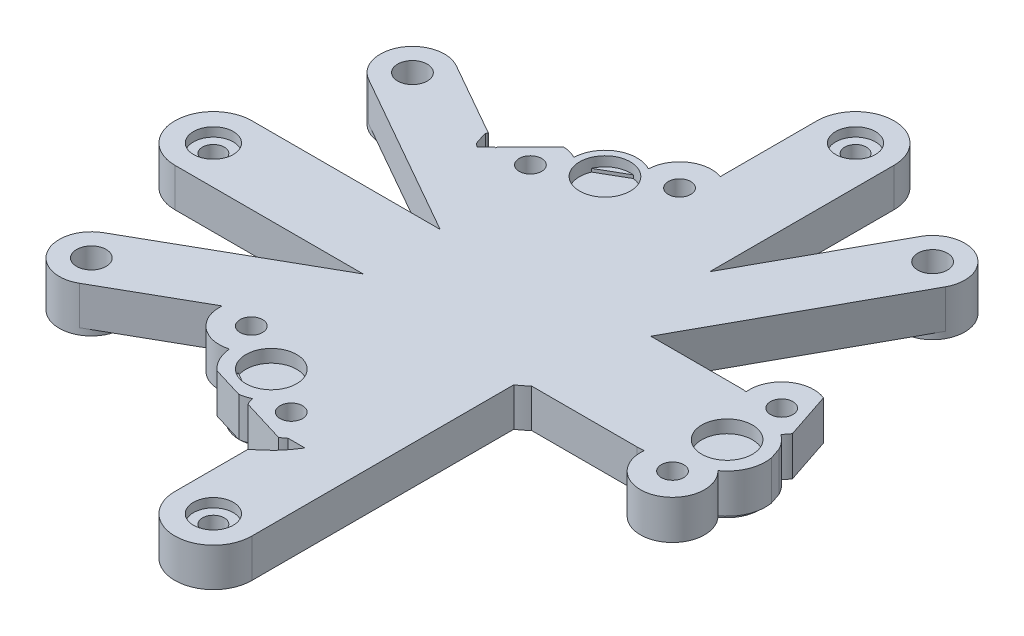
from build123d import *
from build123d.topology import SkipClean

# Parameters (mm, degrees)
BASE_OUTLINE_SKETCH_R          = 3.95
BASE_OUTLINE_SKETCH_R_2        = 1.75
BASE_OUTLINE_SKETCH_R_3        = 3.1
BASE_OUTLINE_SKETCH_R_4        = 2.3
BASE_OUTLINE_DEPTH             = 1.4
INTERFACE_PROFILE_2_SKETCH_R   = 3.95
INTERFACE_PROFILE_2_SKETCH_R_2 = 1.75
INTERFACE_PROFILE_2_SKETCH_R_3 = 1.7
INTERFACE_PROFILE_2_SKETCH_R_4 = 2.3
INTERFACE_PROFILE_2_DEPTH      = 0.1
INTERFACE_PROFILE_3_SKETCH_R   = 1.75
INTERFACE_PROFILE_3_SKETCH_R_2 = 1.7
INTERFACE_PROFILE_3_SKETCH_R_3 = 2.3
INTERFACE_PROFILE_3_DEPTH      = 0.5
INTERFACE_PROFILE_4_SKETCH_R   = 1.75
INTERFACE_PROFILE_4_SKETCH_R_2 = 1.7
INTERFACE_PROFILE_4_SKETCH_R_3 = 2.3
INTERFACE_PROFILE_4_DEPTH      = 1.5
INTERFACE_PROFILE_5_SKETCH_R   = 1.75
INTERFACE_PROFILE_5_SKETCH_R_2 = 2.3
INTERFACE_PROFILE_5_DEPTH      = 0.5
INTERFACE_PROFILE_6_SKETCH_R   = 1.1
INTERFACE_PROFILE_6_SKETCH_R_2 = 2.3
INTERFACE_PROFILE_6_DEPTH      = 1.3
INTERFACE_PROFILE_7_SKETCH_R   = 2.3
INTERFACE_PROFILE_7_DEPTH      = 0.7
INTERFACE_PROFILE_8_SKETCH_R   = 5
INTERFACE_PROFILE_8_SKETCH_R_2 = 2.3
INTERFACE_PROFILE_8_DEPTH      = 0.1
INTERFACE_PROFILE_9_SKETCH_R   = 5
INTERFACE_PROFILE_9_SKETCH_R_2 = 2.3
INTERFACE_PROFILE_9_DEPTH      = 0.9


with BuildPart() as part:
    # Base Outline Sketch → Base Outline (new body)
    with BuildSketch(Plane(origin=(0, 71, 0), x_dir=(1, 0, 0), z_dir=(0, 1, 0))):
        with BuildLine():
            Line((-32.291651246, 8), (-46.185295141, 8))
            Line((-46.185295141, 8), (-29.910571703, 37.590406251))
            ThreePointArc((-29.910571703, 37.590406251), (-31.882057497, 44.381079543), (-38.672730789, 42.409593749))
            Line((-38.672730789, 42.409593749), (-50.291651246, 21.284283828))
            Line((-50.291651246, 21.284283828), (-50.291651246, 50))
            ThreePointArc((-50.291651246, 50), (-56.291651246, 56), (-62.291651246, 50))
            Line((-62.291651246, 50), (-62.291651246, 34.954572734))
            ThreePointArc((-62.291651246, 34.954572734), (-66.315093544, 34.625464052), (-68.784082024, 31.431642464))
            ThreePointArc((-68.784082024, 31.431642464), (-68.883668242, 30.913025667), (-68.927999999, 30.386798062))
            ThreePointArc((-68.927999999, 30.386798062), (-73.791651246, 30.310889132), (-76.289215931, 26.136798062))
            ThreePointArc((-76.289215931, 26.136798062), (-77.35512684, 26.559413065), (-78.489286926, 26.728085547))
            Line((-78.489286926, 26.728085547), (-83.649541024, 21.548414964))
            ThreePointArc((-83.649541024, 21.548414964), (-83.643005829, 21.416889138), (-83.633009125, 21.285581035))
            Line((-83.633009125, 21.285581035), (-83.8107686, 21.386580737))
            Line((-83.8107686, 21.386580737), (-85.20343943, 19.988669705))
            Line((-85.20343943, 19.988669705), (-85.757211082, 20.413215201))
            ThreePointArc((-85.757211082, 20.413215201), (-86.105522751, 21.420146909), (-86.383835717, 22.448628496))
            Line((-86.383835717, 22.448628496), (-86.305419253, 22.677221962))
            Line((-86.305419253, 22.677221962), (-86.256166384, 22.776011296))
            Line((-86.256166384, 22.776011296), (-97.821604208, 29.347282787))
            ThreePointArc((-97.821604208, 29.347282787), (-104.638934033, 27.470047038), (-102.761698284, 20.652717213))
            Line((-102.761698284, 20.652717213), (-76.972915989, 6))
            Line((-76.972915989, 6), (-106.291651246, 6))
            ThreePointArc((-106.291651246, 6), (-112.291651246, 0), (-106.291651246, -6))
            Line((-106.291651246, -6), (-76.972915989, -6))
            Line((-76.972915989, -6), (-102.761698284, -20.652717213))
            ThreePointArc((-102.761698284, -20.652717213), (-105.125718578, -26.277416546), (-100.291651246, -30))
            ThreePointArc((-100.291651246, -30), (-99.0142347, -29.834067332), (-97.821604208, -29.347282787))
            Line((-97.821604208, -29.347282787), (-83.633009125, -21.285581035))
            ThreePointArc((-83.633009125, -21.285581035), (-81.833429855, -25.588743588), (-77.266036714, -26.53458364))
            ThreePointArc((-77.266036714, -26.53458364), (-76.660851993, -28.65876199), (-75.328083566, -30.420042925))
            Line((-75.328083566, -30.420042925), (-70.4166073, -31.916610671))
            ThreePointArc((-70.4166073, -31.916610671), (-69.583050502, -31.73234307), (-68.784082024, -31.431642464))
            ThreePointArc((-68.784082024, -31.431642464), (-68.607205612, -31.999326383), (-68.36419026, -32.541999246))
            Line((-68.36419026, -32.541999246), (-61.538896036, -34.621723271))
            ThreePointArc((-61.538896036, -34.621723271), (-61.075070248, -34.33525847), (-60.645188633, -34))
            Line((-60.645188633, -34), (-58.027344867, -34))
            ThreePointArc((-58.027344867, -34), (-59.924361539, -36.5180637), (-62.291651246, -38.600191578))
            Line((-62.291651246, -38.600191578), (-62.291651246, -50))
            ThreePointArc((-62.291651246, -50), (-56.291651246, -56), (-50.291651246, -50))
            Line((-50.291651246, -50), (-50.291651246, -9.219544457))
            ThreePointArc((-50.291651246, -9.219544457), (-49.489348292, -8.644574861), (-48.741816811, -8))
            Line((-48.741816811, -8), (-32.291651246, -8))
            ThreePointArc((-32.291651246, -8), (-31.774449966, -7.983263921), (-31.259412667, -7.933125709))
            ThreePointArc((-31.259412667, -7.933125709), (-24.59824207, -13.204504795), (-22.824835001, -4.897058824))
            ThreePointArc((-22.824835001, -4.897058824), (-20.756368573, -2.315306833), (-20.370627571, 0.970298223))
            Line((-20.370627571, 0.970298223), (-20.9711323, 2.773459598))
            ThreePointArc((-20.9711323, 2.773459598), (-21.771503753, 3.945664284), (-22.824835001, 4.897058823))
            ThreePointArc((-22.824835001, 4.897058823), (-22.387173453, 5.376691952), (-22.015356327, 5.908995993))
            Line((-22.015356327, 5.908995993), (-24.422675355, 13.137556374))
            ThreePointArc((-24.422675355, 13.137556374), (-29.320205782, 12.478423987), (-31.259412667, 7.933125709))
            ThreePointArc((-31.259412667, 7.933125709), (-31.774449966, 7.983263921), (-32.291651246, 8))
        make_face()
        with Locations(Location((-71.291651246, -25.980762114, 0), (0, 0, 270))):
            Circle(BASE_OUTLINE_SKETCH_R, mode=Mode.SUBTRACT)
        with Locations(Location((-63.930435314, -30.230762114, 0), (0, 0, 270))):
            Circle(BASE_OUTLINE_SKETCH_R_2, mode=Mode.SUBTRACT)
        with Locations(Location((-26.291651246, 0, 0), (0, 0, 270))):
            Circle(BASE_OUTLINE_SKETCH_R, mode=Mode.SUBTRACT)
        with Locations(Location((-56.291651246, -50, 0), (0, 0, 270))):
            Circle(BASE_OUTLINE_SKETCH_R_3, mode=Mode.SUBTRACT)
        with Locations(Location((-26.291651246, -8.5, 0), (0, 0, 270))):
            Circle(BASE_OUTLINE_SKETCH_R_2, mode=Mode.SUBTRACT)
        with Locations(Location((-78.652867178, -21.730762114, 0), (0, 0, 270))):
            Circle(BASE_OUTLINE_SKETCH_R_2, mode=Mode.SUBTRACT)
        with Locations(Location((-100.291651246, -25, 0), (0, 0, 270))):
            Circle(BASE_OUTLINE_SKETCH_R_4, mode=Mode.SUBTRACT)
        with Locations(Location((-71.291651246, 25.980762113, 0), (0, 0, 270))):
            Circle(BASE_OUTLINE_SKETCH_R, mode=Mode.SUBTRACT)
        with Locations(Location((-34.291651246, 40, 0), (0, 0, 270))):
            Circle(BASE_OUTLINE_SKETCH_R_4, mode=Mode.SUBTRACT)
        with Locations(Location((-26.291651246, 8.5, 0), (0, 0, 270))):
            Circle(BASE_OUTLINE_SKETCH_R_2, mode=Mode.SUBTRACT)
        with Locations(Location((-63.930435314, 30.230762113, 0), (0, 0, 270))):
            Circle(BASE_OUTLINE_SKETCH_R_2, mode=Mode.SUBTRACT)
        with Locations(Location((-56.291651246, 50, 0), (0, 0, 270))):
            Circle(BASE_OUTLINE_SKETCH_R_3, mode=Mode.SUBTRACT)
        with Locations(Location((-78.652867178, 21.730762114, 0), (0, 0, 270))):
            Circle(BASE_OUTLINE_SKETCH_R_2, mode=Mode.SUBTRACT)
        with Locations(Location((-106.291651246, 0, 0), (0, 0, 270))):
            Circle(BASE_OUTLINE_SKETCH_R_3, mode=Mode.SUBTRACT)
        with Locations(Location((-100.291651246, 25, 0), (0, 0, 270))):
            Circle(BASE_OUTLINE_SKETCH_R_4, mode=Mode.SUBTRACT)
    extrude(amount=-BASE_OUTLINE_DEPTH)

    # Interface Profile 2 Sketch → Interface Profile 2 (add)
    with BuildSketch(Plane(origin=(0, 69.6, 0), x_dir=(1, 0, 0), z_dir=(0, 1, 0))):
        with BuildLine():
            Line((-32.291651246, 8), (-46.185295141, 8))
            Line((-46.185295141, 8), (-29.910571703, 37.590406251))
            ThreePointArc((-29.910571703, 37.590406251), (-31.882057497, 44.381079543), (-38.672730789, 42.409593749))
            Line((-38.672730789, 42.409593749), (-50.291651246, 21.284283828))
            Line((-50.291651246, 21.284283828), (-50.291651246, 50))
            ThreePointArc((-50.291651246, 50), (-56.291651246, 56), (-62.291651246, 50))
            Line((-62.291651246, 50), (-62.291651246, 34.954572734))
            ThreePointArc((-62.291651246, 34.954572734), (-66.315093544, 34.625464052), (-68.784082024, 31.431642464))
            ThreePointArc((-68.784082024, 31.431642464), (-68.883668242, 30.913025667), (-68.927999999, 30.386798062))
            ThreePointArc((-68.927999999, 30.386798062), (-73.791651246, 30.310889132), (-76.289215931, 26.136798062))
            ThreePointArc((-76.289215931, 26.136798062), (-77.35512684, 26.559413065), (-78.489286926, 26.728085547))
            Line((-78.489286926, 26.728085547), (-83.649541024, 21.548414964))
            ThreePointArc((-83.649541024, 21.548414964), (-83.643005829, 21.416889138), (-83.633009125, 21.285581035))
            Line((-83.633009125, 21.285581035), (-83.8107686, 21.386580737))
            Line((-83.8107686, 21.386580737), (-85.20343943, 19.988669705))
            Line((-85.20343943, 19.988669705), (-85.757211082, 20.413215201))
            ThreePointArc((-85.757211082, 20.413215201), (-86.105522751, 21.420146909), (-86.383835717, 22.448628496))
            Line((-86.383835717, 22.448628496), (-86.305419253, 22.677221962))
            Line((-86.305419253, 22.677221962), (-86.256166384, 22.776011296))
            Line((-86.256166384, 22.776011296), (-97.821604208, 29.347282787))
            ThreePointArc((-97.821604208, 29.347282787), (-104.638934033, 27.470047038), (-102.761698284, 20.652717213))
            Line((-102.761698284, 20.652717213), (-76.972915989, 6))
            Line((-76.972915989, 6), (-106.291651246, 6))
            ThreePointArc((-106.291651246, 6), (-112.291651246, 0), (-106.291651246, -6))
            Line((-106.291651246, -6), (-76.972915989, -6))
            Line((-76.972915989, -6), (-102.761698284, -20.652717213))
            ThreePointArc((-102.761698284, -20.652717213), (-105.125718578, -26.277416546), (-100.291651246, -30))
            ThreePointArc((-100.291651246, -30), (-99.0142347, -29.834067332), (-97.821604208, -29.347282787))
            Line((-97.821604208, -29.347282787), (-83.633009125, -21.285581035))
            ThreePointArc((-83.633009125, -21.285581035), (-81.833429855, -25.588743588), (-77.266036714, -26.53458364))
            ThreePointArc((-77.266036714, -26.53458364), (-76.660851993, -28.65876199), (-75.328083566, -30.420042925))
            Line((-75.328083566, -30.420042925), (-70.4166073, -31.916610671))
            ThreePointArc((-70.4166073, -31.916610671), (-69.583050502, -31.73234307), (-68.784082024, -31.431642464))
            ThreePointArc((-68.784082024, -31.431642464), (-68.607205612, -31.999326383), (-68.36419026, -32.541999246))
            Line((-68.36419026, -32.541999246), (-61.538896036, -34.621723271))
            ThreePointArc((-61.538896036, -34.621723271), (-61.075070248, -34.33525847), (-60.645188633, -34))
            Line((-60.645188633, -34), (-58.027344867, -34))
            ThreePointArc((-58.027344867, -34), (-59.924361539, -36.5180637), (-62.291651246, -38.600191578))
            Line((-62.291651246, -38.600191578), (-62.291651246, -50))
            ThreePointArc((-62.291651246, -50), (-56.291651246, -56), (-50.291651246, -50))
            Line((-50.291651246, -50), (-50.291651246, -9.219544457))
            ThreePointArc((-50.291651246, -9.219544457), (-49.489348292, -8.644574861), (-48.741816811, -8))
            Line((-48.741816811, -8), (-32.291651246, -8))
            ThreePointArc((-32.291651246, -8), (-31.774449966, -7.983263921), (-31.259412667, -7.933125709))
            ThreePointArc((-31.259412667, -7.933125709), (-24.59824207, -13.204504795), (-22.824835001, -4.897058824))
            ThreePointArc((-22.824835001, -4.897058824), (-20.756368573, -2.315306833), (-20.370627571, 0.970298223))
            Line((-20.370627571, 0.970298223), (-20.9711323, 2.773459598))
            ThreePointArc((-20.9711323, 2.773459598), (-21.771503753, 3.945664284), (-22.824835001, 4.897058823))
            ThreePointArc((-22.824835001, 4.897058823), (-22.387173453, 5.376691952), (-22.015356327, 5.908995993))
            Line((-22.015356327, 5.908995993), (-24.422675355, 13.137556374))
            ThreePointArc((-24.422675355, 13.137556374), (-29.320205782, 12.478423987), (-31.259412667, 7.933125709))
            ThreePointArc((-31.259412667, 7.933125709), (-31.774449966, 7.983263921), (-32.291651246, 8))
        make_face()
        with Locations(Location((-71.291651246, -25.980762114, 0), (0, 0, 270))):
            Circle(INTERFACE_PROFILE_2_SKETCH_R, mode=Mode.SUBTRACT)
        with Locations(Location((-63.930435314, -30.230762114, 0), (0, 0, 270))):
            Circle(INTERFACE_PROFILE_2_SKETCH_R_2, mode=Mode.SUBTRACT)
        with Locations(Location((-26.291651246, 0, 0), (0, 0, 270))):
            Circle(INTERFACE_PROFILE_2_SKETCH_R, mode=Mode.SUBTRACT)
        with Locations(Location((-56.291651246, -50, 0), (0, 0, 270))):
            Circle(INTERFACE_PROFILE_2_SKETCH_R_3, mode=Mode.SUBTRACT)
        with Locations(Location((-56.291651246, 50, 0), (0, 0, 270))):
            Circle(INTERFACE_PROFILE_2_SKETCH_R_3, mode=Mode.SUBTRACT)
        with Locations(Location((-106.291651246, 0, 0), (0, 0, 270))):
            Circle(INTERFACE_PROFILE_2_SKETCH_R_3, mode=Mode.SUBTRACT)
        with Locations(Location((-26.291651246, -8.5, 0), (0, 0, 270))):
            Circle(INTERFACE_PROFILE_2_SKETCH_R_2, mode=Mode.SUBTRACT)
        with Locations(Location((-78.652867178, -21.730762114, 0), (0, 0, 270))):
            Circle(INTERFACE_PROFILE_2_SKETCH_R_2, mode=Mode.SUBTRACT)
        with Locations(Location((-100.291651246, -25, 0), (0, 0, 270))):
            Circle(INTERFACE_PROFILE_2_SKETCH_R_4, mode=Mode.SUBTRACT)
        with Locations(Location((-71.291651246, 25.980762113, 0), (0, 0, 270))):
            Circle(INTERFACE_PROFILE_2_SKETCH_R, mode=Mode.SUBTRACT)
        with Locations(Location((-34.291651246, 40, 0), (0, 0, 270))):
            Circle(INTERFACE_PROFILE_2_SKETCH_R_4, mode=Mode.SUBTRACT)
        with Locations(Location((-26.291651246, 8.5, 0), (0, 0, 270))):
            Circle(INTERFACE_PROFILE_2_SKETCH_R_2, mode=Mode.SUBTRACT)
        with Locations(Location((-63.930435314, 30.230762113, 0), (0, 0, 270))):
            Circle(INTERFACE_PROFILE_2_SKETCH_R_2, mode=Mode.SUBTRACT)
        with Locations(Location((-78.652867178, 21.730762114, 0), (0, 0, 270))):
            Circle(INTERFACE_PROFILE_2_SKETCH_R_2, mode=Mode.SUBTRACT)
        with Locations(Location((-100.291651246, 25, 0), (0, 0, 270))):
            Circle(INTERFACE_PROFILE_2_SKETCH_R_4, mode=Mode.SUBTRACT)
    extrude(amount=-INTERFACE_PROFILE_2_DEPTH)

    # Interface Profile 3 Sketch → Interface Profile 3 (add)
    with SkipClean():  # the faces are left unmerged after this step: merging them gives an invalid solid
        with BuildSketch(Plane(origin=(0, 69.5, 0), x_dir=(1, 0, 0), z_dir=(0, 1, 0))):
            with BuildLine():
                Line((-32.291651246, 8), (-46.185295141, 8))
                Line((-46.185295141, 8), (-29.910571703, 37.590406251))
                ThreePointArc((-29.910571703, 37.590406251), (-31.882057497, 44.381079543), (-38.672730789, 42.409593749))
                Line((-38.672730789, 42.409593749), (-50.291651246, 21.284283828))
                Line((-50.291651246, 21.284283828), (-50.291651246, 50))
                ThreePointArc((-50.291651246, 50), (-56.291651246, 56), (-62.291651246, 50))
                Line((-62.291651246, 50), (-62.291651246, 34.954572734))
                ThreePointArc((-62.291651246, 34.954572734), (-66.315093544, 34.625464052), (-68.784082024, 31.431642464))
                ThreePointArc((-68.784082024, 31.431642464), (-68.883668242, 30.913025667), (-68.927999999, 30.386798062))
                ThreePointArc((-68.927999999, 30.386798062), (-73.791651246, 30.310889132), (-76.289215931, 26.136798062))
                ThreePointArc((-76.289215931, 26.136798062), (-77.35512684, 26.559413065), (-78.489286926, 26.728085547))
                Line((-78.489286926, 26.728085547), (-83.649541024, 21.548414964))
                ThreePointArc((-83.649541024, 21.548414964), (-83.643005829, 21.416889138), (-83.633009125, 21.285581035))
                Line((-83.633009125, 21.285581035), (-83.8107686, 21.386580737))
                Line((-83.8107686, 21.386580737), (-85.20343943, 19.988669705))
                Line((-85.20343943, 19.988669705), (-85.757211082, 20.413215201))
                ThreePointArc((-85.757211082, 20.413215201), (-86.105522751, 21.420146909), (-86.383835717, 22.448628496))
                Line((-86.383835717, 22.448628496), (-86.305419253, 22.677221962))
                Line((-86.305419253, 22.677221962), (-86.256166384, 22.776011296))
                Line((-86.256166384, 22.776011296), (-97.821604208, 29.347282787))
                ThreePointArc((-97.821604208, 29.347282787), (-104.638934033, 27.470047038), (-102.761698284, 20.652717213))
                Line((-102.761698284, 20.652717213), (-76.972915989, 6))
                Line((-76.972915989, 6), (-106.291651246, 6))
                ThreePointArc((-106.291651246, 6), (-112.291651246, 0), (-106.291651246, -6))
                Line((-106.291651246, -6), (-76.972915989, -6))
                Line((-76.972915989, -6), (-102.761698284, -20.652717213))
                ThreePointArc((-102.761698284, -20.652717213), (-105.125718578, -26.277416546), (-100.291651246, -30))
                ThreePointArc((-100.291651246, -30), (-99.0142347, -29.834067332), (-97.821604208, -29.347282787))
                Line((-97.821604208, -29.347282787), (-83.633009125, -21.285581035))
                ThreePointArc((-83.633009125, -21.285581035), (-81.833429855, -25.588743588), (-77.266036714, -26.53458364))
                ThreePointArc((-77.266036714, -26.53458364), (-76.660851993, -28.65876199), (-75.328083566, -30.420042925))
                Line((-75.328083566, -30.420042925), (-70.4166073, -31.916610671))
                ThreePointArc((-70.4166073, -31.916610671), (-69.583050502, -31.73234307), (-68.784082024, -31.431642464))
                ThreePointArc((-68.784082024, -31.431642464), (-68.607205612, -31.999326383), (-68.36419026, -32.541999246))
                Line((-68.36419026, -32.541999246), (-61.538896036, -34.621723271))
                ThreePointArc((-61.538896036, -34.621723271), (-61.075070248, -34.33525847), (-60.645188633, -34))
                Line((-60.645188633, -34), (-58.027344867, -34))
                ThreePointArc((-58.027344867, -34), (-59.924361539, -36.5180637), (-62.291651246, -38.600191578))
                Line((-62.291651246, -38.600191578), (-62.291651246, -50))
                ThreePointArc((-62.291651246, -50), (-56.291651246, -56), (-50.291651246, -50))
                Line((-50.291651246, -50), (-50.291651246, -9.219544457))
                ThreePointArc((-50.291651246, -9.219544457), (-49.489348292, -8.644574861), (-48.741816811, -8))
                Line((-48.741816811, -8), (-32.291651246, -8))
                ThreePointArc((-32.291651246, -8), (-31.774449966, -7.983263921), (-31.259412667, -7.933125709))
                ThreePointArc((-31.259412667, -7.933125709), (-24.59824207, -13.204504794), (-22.824835001, -4.897058824))
                ThreePointArc((-22.824835001, -4.897058824), (-20.756368573, -2.315306833), (-20.370627571, 0.970298223))
                Line((-20.370627571, 0.970298223), (-20.9711323, 2.773459598))
                ThreePointArc((-20.9711323, 2.773459598), (-21.771503753, 3.945664284), (-22.824835001, 4.897058824))
                ThreePointArc((-22.824835001, 4.897058824), (-22.387173453, 5.376691952), (-22.015356327, 5.908995993))
                Line((-22.015356327, 5.908995993), (-24.422675355, 13.137556374))
                ThreePointArc((-24.422675355, 13.137556374), (-29.320205782, 12.478423987), (-31.259412667, 7.933125709))
                ThreePointArc((-31.259412667, 7.933125709), (-31.774449966, 7.983263921), (-32.291651246, 8))
            make_face()
            with Locations(Location((-63.930435314, -30.230762114, 0), (0, 0, 270))):
                Circle(INTERFACE_PROFILE_3_SKETCH_R, mode=Mode.SUBTRACT)
            with Locations(Location((-56.291651246, -50, 0), (0, 0, 270))):
                Circle(INTERFACE_PROFILE_3_SKETCH_R_2, mode=Mode.SUBTRACT)
            with Locations(Location((-56.291651246, 50, 0), (0, 0, 270.000000001))):
                Circle(INTERFACE_PROFILE_3_SKETCH_R_2, mode=Mode.SUBTRACT)
            with Locations(Location((-106.291651246, 0, 0), (0, 0, 270))):
                Circle(INTERFACE_PROFILE_3_SKETCH_R_2, mode=Mode.SUBTRACT)
            with Locations(Location((-26.291651246, -8.5, 0), (0, 0, 270))):
                Circle(INTERFACE_PROFILE_3_SKETCH_R, mode=Mode.SUBTRACT)
            with Locations(Location((-78.652867178, -21.730762114, 0), (0, 0, 270))):
                Circle(INTERFACE_PROFILE_3_SKETCH_R, mode=Mode.SUBTRACT)
            with Locations(Location((-100.291651246, -25, 0), (0, 0, 270))):
                Circle(INTERFACE_PROFILE_3_SKETCH_R_3, mode=Mode.SUBTRACT)
            with Locations(Location((-34.291651246, 40, 0), (0, 0, 270.000000001))):
                Circle(INTERFACE_PROFILE_3_SKETCH_R_3, mode=Mode.SUBTRACT)
            with Locations(Location((-26.291651246, 8.5, 0), (0, 0, 270))):
                Circle(INTERFACE_PROFILE_3_SKETCH_R, mode=Mode.SUBTRACT)
            with Locations(Location((-63.930435314, 30.230762114, 0), (0, 0, 270.000000001))):
                Circle(INTERFACE_PROFILE_3_SKETCH_R, mode=Mode.SUBTRACT)
            with Locations(Location((-78.652867178, 21.730762114, 0), (0, 0, 270))):
                Circle(INTERFACE_PROFILE_3_SKETCH_R, mode=Mode.SUBTRACT)
            with Locations(Location((-100.291651246, 25, 0), (0, 0, 270))):
                Circle(INTERFACE_PROFILE_3_SKETCH_R_3, mode=Mode.SUBTRACT)
            with BuildLine():
                Line((-70.802674502, -29.900379664), (-74.93062799, -27.517104607))
                ThreePointArc((-74.93062799, -27.517104607), (-72.075405627, -22.109298686), (-67.341651246, -25.980762114))
                ThreePointArc((-67.341651246, -25.980762114), (-68.330742759, -28.595245032), (-70.802674502, -29.900379664))
            make_face(mode=Mode.SUBTRACT)
            with BuildLine():
                Line((-23.141651246, 2.383275058), (-23.141651246, -2.383275058))
                ThreePointArc((-23.141651246, -2.383275058), (-30.241651246, 0), (-23.141651246, 2.383275058))
            make_face(mode=Mode.SUBTRACT)
            with BuildLine():
                Line((-74.93062799, 27.517104607), (-70.802674502, 29.900379664))
                ThreePointArc((-70.802674502, 29.900379664), (-68.330742759, 28.595245032), (-67.341651246, 25.980762114))
                ThreePointArc((-67.341651246, 25.980762114), (-72.075405627, 22.109298686), (-74.93062799, 27.517104607))
            make_face(mode=Mode.SUBTRACT)
        extrude(amount=-INTERFACE_PROFILE_3_DEPTH)

    # Interface Profile 4 Sketch → Interface Profile 4 (add)
    with SkipClean():  # the faces are left unmerged after this step: merging them gives an invalid solid
        with BuildSketch(Plane(origin=(0, 69, 0), x_dir=(1, 0, 0), z_dir=(0, 1, 0))):
            with BuildLine():
                Line((-32.291651246, 8), (-46.185295141, 8))
                Line((-46.185295141, 8), (-29.910571703, 37.590406251))
                ThreePointArc((-29.910571703, 37.590406251), (-31.882057497, 44.381079543), (-38.672730789, 42.409593749))
                Line((-38.672730789, 42.409593749), (-50.291651246, 21.284283828))
                Line((-50.291651246, 21.284283828), (-50.291651246, 50))
                ThreePointArc((-50.291651246, 50), (-56.291651246, 56), (-62.291651246, 50))
                Line((-62.291651246, 50), (-62.291651246, 34.954572734))
                ThreePointArc((-62.291651246, 34.954572734), (-66.315093544, 34.625464052), (-68.784082024, 31.431642464))
                ThreePointArc((-68.784082024, 31.431642464), (-68.883668242, 30.913025667), (-68.927999999, 30.386798062))
                ThreePointArc((-68.927999999, 30.386798062), (-73.791651246, 30.310889132), (-76.289215931, 26.136798062))
                ThreePointArc((-76.289215931, 26.136798062), (-77.35512684, 26.559413065), (-78.489286926, 26.728085547))
                Line((-78.489286926, 26.728085547), (-83.649541024, 21.548414964))
                ThreePointArc((-83.649541024, 21.548414964), (-83.643005829, 21.416889138), (-83.633009125, 21.285581035))
                Line((-83.633009125, 21.285581035), (-83.8107686, 21.386580737))
                Line((-83.8107686, 21.386580737), (-85.20343943, 19.988669705))
                Line((-85.20343943, 19.988669705), (-85.757211082, 20.413215201))
                ThreePointArc((-85.757211082, 20.413215201), (-86.105522751, 21.420146909), (-86.383835717, 22.448628496))
                Line((-86.383835717, 22.448628496), (-86.305419253, 22.677221962))
                Line((-86.305419253, 22.677221962), (-86.256166384, 22.776011296))
                Line((-86.256166384, 22.776011296), (-97.821604208, 29.347282787))
                ThreePointArc((-97.821604208, 29.347282787), (-104.638934033, 27.470047038), (-102.761698284, 20.652717213))
                Line((-102.761698284, 20.652717213), (-76.972915989, 6))
                Line((-76.972915989, 6), (-106.291651246, 6))
                ThreePointArc((-106.291651246, 6), (-112.291651246, 0), (-106.291651246, -6))
                Line((-106.291651246, -6), (-76.972915989, -6))
                Line((-76.972915989, -6), (-102.761698284, -20.652717213))
                ThreePointArc((-102.761698284, -20.652717213), (-105.125718578, -26.277416546), (-100.291651246, -30))
                ThreePointArc((-100.291651246, -30), (-99.0142347, -29.834067332), (-97.821604208, -29.347282787))
                Line((-97.821604208, -29.347282787), (-83.633009125, -21.285581035))
                ThreePointArc((-83.633009125, -21.285581035), (-81.833429855, -25.588743588), (-77.266036714, -26.53458364))
                ThreePointArc((-77.266036714, -26.53458364), (-76.660851993, -28.65876199), (-75.328083566, -30.420042925))
                Line((-75.328083566, -30.420042925), (-70.4166073, -31.916610671))
                ThreePointArc((-70.4166073, -31.916610671), (-69.583050502, -31.73234307), (-68.784082024, -31.431642464))
                ThreePointArc((-68.784082024, -31.431642464), (-68.607205612, -31.999326383), (-68.36419026, -32.541999246))
                Line((-68.36419026, -32.541999246), (-61.538896036, -34.621723271))
                ThreePointArc((-61.538896036, -34.621723271), (-61.075070248, -34.33525847), (-60.645188633, -34))
                Line((-60.645188633, -34), (-58.027344867, -34))
                ThreePointArc((-58.027344867, -34), (-59.924361539, -36.5180637), (-62.291651246, -38.600191578))
                Line((-62.291651246, -38.600191578), (-62.291651246, -50))
                ThreePointArc((-62.291651246, -50), (-56.291651246, -56), (-50.291651246, -50))
                Line((-50.291651246, -50), (-50.291651246, -9.219544457))
                ThreePointArc((-50.291651246, -9.219544457), (-49.489348292, -8.644574861), (-48.741816811, -8))
                Line((-48.741816811, -8), (-32.291651246, -8))
                ThreePointArc((-32.291651246, -8), (-31.774449966, -7.983263921), (-31.259412667, -7.933125709))
                ThreePointArc((-31.259412667, -7.933125709), (-24.59824207, -13.204504795), (-22.824835001, -4.897058824))
                ThreePointArc((-22.824835001, -4.897058824), (-20.756368573, -2.315306833), (-20.370627571, 0.970298223))
                Line((-20.370627571, 0.970298223), (-20.9711323, 2.773459598))
                ThreePointArc((-20.9711323, 2.773459598), (-21.771503753, 3.945664284), (-22.824835001, 4.897058823))
                ThreePointArc((-22.824835001, 4.897058823), (-22.387173453, 5.376691952), (-22.015356327, 5.908995993))
                Line((-22.015356327, 5.908995993), (-24.422675355, 13.137556374))
                ThreePointArc((-24.422675355, 13.137556374), (-29.320205782, 12.478423987), (-31.259412667, 7.933125709))
                ThreePointArc((-31.259412667, 7.933125709), (-31.774449966, 7.983263921), (-32.291651246, 8))
            make_face()
            with Locations(Location((-63.930435314, -30.230762114, 0), (0, 0, 270))):
                Circle(INTERFACE_PROFILE_4_SKETCH_R, mode=Mode.SUBTRACT)
            with Locations(Location((-56.291651246, -50, 0), (0, 0, 270))):
                Circle(INTERFACE_PROFILE_4_SKETCH_R_2, mode=Mode.SUBTRACT)
            with Locations(Location((-56.291651246, 50, 0), (0, 0, 270))):
                Circle(INTERFACE_PROFILE_4_SKETCH_R_2, mode=Mode.SUBTRACT)
            with Locations(Location((-106.291651246, 0, 0), (0, 0, 270))):
                Circle(INTERFACE_PROFILE_4_SKETCH_R_2, mode=Mode.SUBTRACT)
            with Locations(Location((-26.291651246, -8.5, 0), (0, 0, 270))):
                Circle(INTERFACE_PROFILE_4_SKETCH_R, mode=Mode.SUBTRACT)
            with Locations(Location((-78.652867178, -21.730762114, 0), (0, 0, 270))):
                Circle(INTERFACE_PROFILE_4_SKETCH_R, mode=Mode.SUBTRACT)
            with Locations(Location((-100.291651246, -25, 0), (0, 0, 270))):
                Circle(INTERFACE_PROFILE_4_SKETCH_R_3, mode=Mode.SUBTRACT)
            with Locations(Location((-34.291651246, 40, 0), (0, 0, 270))):
                Circle(INTERFACE_PROFILE_4_SKETCH_R_3, mode=Mode.SUBTRACT)
            with Locations(Location((-26.291651246, 8.5, 0), (0, 0, 270))):
                Circle(INTERFACE_PROFILE_4_SKETCH_R, mode=Mode.SUBTRACT)
            with Locations(Location((-63.930435314, 30.230762113, 0), (0, 0, 270))):
                Circle(INTERFACE_PROFILE_4_SKETCH_R, mode=Mode.SUBTRACT)
            with Locations(Location((-78.652867178, 21.730762114, 0), (0, 0, 270))):
                Circle(INTERFACE_PROFILE_4_SKETCH_R, mode=Mode.SUBTRACT)
            with Locations(Location((-100.291651246, 25, 0), (0, 0, 270))):
                Circle(INTERFACE_PROFILE_4_SKETCH_R_3, mode=Mode.SUBTRACT)
        extrude(amount=-INTERFACE_PROFILE_4_DEPTH)

    # Interface Profile 5 Sketch → Interface Profile 5 (add)
    with SkipClean():  # the faces are left unmerged after this step: merging them gives an invalid solid
        with BuildSketch(Plane(origin=(0, 67.5, 0), x_dir=(1, 0, 0), z_dir=(0, 1, 0))):
            with BuildLine():
                Line((-32.291651246, 8), (-46.185295141, 8))
                Line((-46.185295141, 8), (-29.910571703, 37.590406251))
                ThreePointArc((-29.910571703, 37.590406251), (-31.882057497, 44.381079543), (-38.672730789, 42.409593749))
                Line((-38.672730789, 42.409593749), (-50.291651246, 21.284283828))
                Line((-50.291651246, 21.284283828), (-50.291651246, 50))
                ThreePointArc((-50.291651246, 50), (-56.291651246, 56), (-62.291651246, 50))
                Line((-62.291651246, 50), (-62.291651246, 34.954572734))
                ThreePointArc((-62.291651246, 34.954572734), (-66.315093544, 34.625464052), (-68.784082024, 31.431642464))
                ThreePointArc((-68.784082024, 31.431642464), (-68.883668242, 30.913025667), (-68.927999999, 30.386798062))
                ThreePointArc((-68.927999999, 30.386798062), (-73.791651246, 30.310889132), (-76.289215931, 26.136798062))
                ThreePointArc((-76.289215931, 26.136798062), (-77.35512684, 26.559413065), (-78.489286926, 26.728085547))
                Line((-78.489286926, 26.728085547), (-83.649541024, 21.548414964))
                ThreePointArc((-83.649541024, 21.548414964), (-83.643005829, 21.416889138), (-83.633009125, 21.285581035))
                Line((-83.633009125, 21.285581035), (-83.8107686, 21.386580737))
                Line((-83.8107686, 21.386580737), (-85.20343943, 19.988669705))
                Line((-85.20343943, 19.988669705), (-85.757211082, 20.413215201))
                ThreePointArc((-85.757211082, 20.413215201), (-86.105522751, 21.420146909), (-86.383835717, 22.448628496))
                Line((-86.383835717, 22.448628496), (-86.305419253, 22.677221962))
                Line((-86.305419253, 22.677221962), (-86.256166384, 22.776011296))
                Line((-86.256166384, 22.776011296), (-97.821604208, 29.347282787))
                ThreePointArc((-97.821604208, 29.347282787), (-104.638934033, 27.470047038), (-102.761698284, 20.652717213))
                Line((-102.761698284, 20.652717213), (-76.972915989, 6))
                Line((-76.972915989, 6), (-106.291651246, 6))
                ThreePointArc((-106.291651246, 6), (-112.291651246, 0), (-106.291651246, -6))
                Line((-106.291651246, -6), (-76.972915989, -6))
                Line((-76.972915989, -6), (-102.761698284, -20.652717213))
                ThreePointArc((-102.761698284, -20.652717213), (-105.125718578, -26.277416546), (-100.291651246, -30))
                ThreePointArc((-100.291651246, -30), (-99.0142347, -29.834067332), (-97.821604208, -29.347282787))
                Line((-97.821604208, -29.347282787), (-83.633009125, -21.285581035))
                ThreePointArc((-83.633009125, -21.285581035), (-81.833429855, -25.588743588), (-77.266036714, -26.53458364))
                ThreePointArc((-77.266036714, -26.53458364), (-76.660851993, -28.65876199), (-75.328083566, -30.420042925))
                Line((-75.328083566, -30.420042925), (-70.4166073, -31.916610671))
                ThreePointArc((-70.4166073, -31.916610671), (-69.583050502, -31.73234307), (-68.784082024, -31.431642464))
                ThreePointArc((-68.784082024, -31.431642464), (-68.607205612, -31.999326383), (-68.36419026, -32.541999246))
                Line((-68.36419026, -32.541999246), (-61.538896036, -34.621723271))
                ThreePointArc((-61.538896036, -34.621723271), (-61.075070248, -34.33525847), (-60.645188633, -34))
                Line((-60.645188633, -34), (-58.027344867, -34))
                ThreePointArc((-58.027344867, -34), (-59.924361539, -36.5180637), (-62.291651246, -38.600191578))
                Line((-62.291651246, -38.600191578), (-62.291651246, -50))
                ThreePointArc((-62.291651246, -50), (-56.291651246, -56), (-50.291651246, -50))
                Line((-50.291651246, -50), (-50.291651246, -9.219544457))
                ThreePointArc((-50.291651246, -9.219544457), (-49.489348292, -8.644574861), (-48.741816811, -8))
                Line((-48.741816811, -8), (-32.291651246, -8))
                ThreePointArc((-32.291651246, -8), (-31.774449966, -7.983263921), (-31.259412667, -7.933125709))
                ThreePointArc((-31.259412667, -7.933125709), (-24.59824207, -13.204504795), (-22.824835001, -4.897058824))
                ThreePointArc((-22.824835001, -4.897058824), (-20.756368573, -2.315306833), (-20.370627571, 0.970298223))
                Line((-20.370627571, 0.970298223), (-20.9711323, 2.773459598))
                ThreePointArc((-20.9711323, 2.773459598), (-21.771503753, 3.945664284), (-22.824835001, 4.897058823))
                ThreePointArc((-22.824835001, 4.897058823), (-22.387173453, 5.376691952), (-22.015356327, 5.908995993))
                Line((-22.015356327, 5.908995993), (-24.422675355, 13.137556374))
                ThreePointArc((-24.422675355, 13.137556374), (-29.320205782, 12.478423987), (-31.259412667, 7.933125709))
                ThreePointArc((-31.259412667, 7.933125709), (-31.774449966, 7.983263921), (-32.291651246, 8))
            make_face()
            with Locations(Location((-63.930435314, -30.230762114, 0), (0, 0, 270))):
                Circle(INTERFACE_PROFILE_5_SKETCH_R, mode=Mode.SUBTRACT)
            with Locations(Location((-26.291651246, -8.5, 0), (0, 0, 270))):
                Circle(INTERFACE_PROFILE_5_SKETCH_R, mode=Mode.SUBTRACT)
            with Locations(Location((-78.652867178, -21.730762114, 0), (0, 0, 270))):
                Circle(INTERFACE_PROFILE_5_SKETCH_R, mode=Mode.SUBTRACT)
            with Locations(Location((-100.291651246, -25, 0), (0, 0, 270))):
                Circle(INTERFACE_PROFILE_5_SKETCH_R_2, mode=Mode.SUBTRACT)
            with Locations(Location((-34.291651246, 40, 0), (0, 0, 270))):
                Circle(INTERFACE_PROFILE_5_SKETCH_R_2, mode=Mode.SUBTRACT)
            with Locations(Location((-26.291651246, 8.5, 0), (0, 0, 270))):
                Circle(INTERFACE_PROFILE_5_SKETCH_R, mode=Mode.SUBTRACT)
            with Locations(Location((-63.930435314, 30.230762113, 0), (0, 0, 270))):
                Circle(INTERFACE_PROFILE_5_SKETCH_R, mode=Mode.SUBTRACT)
            with Locations(Location((-78.652867178, 21.730762114, 0), (0, 0, 270))):
                Circle(INTERFACE_PROFILE_5_SKETCH_R, mode=Mode.SUBTRACT)
            with Locations(Location((-100.291651246, 25, 0), (0, 0, 270))):
                Circle(INTERFACE_PROFILE_5_SKETCH_R_2, mode=Mode.SUBTRACT)
            Polygon((-59.58254778, -50), (-57.937099513, -47.15), (-54.646202979, -47.15), (-53.000754712, -50), (-54.646202979, -52.85), (-57.937099513, -52.85), align=None, mode=Mode.SUBTRACT)
            Polygon((-54.646202979, 52.85), (-53.000754712, 50), (-54.646202979, 47.15), (-57.937099513, 47.15), (-59.58254778, 50), (-57.937099513, 52.85), align=None, mode=Mode.SUBTRACT)
            Polygon((-104.646202979, 2.85), (-103.000754712, 0), (-104.646202979, -2.85), (-107.937099513, -2.85), (-109.58254778, 0), (-107.937099513, 2.85), align=None, mode=Mode.SUBTRACT)
        extrude(amount=-INTERFACE_PROFILE_5_DEPTH)

    # Interface Profile 6 Sketch → Interface Profile 6 (add)
    with SkipClean():  # the faces are left unmerged after this step: merging them gives an invalid solid
        with BuildSketch(Plane(origin=(0, 67, 0), x_dir=(1, 0, 0), z_dir=(0, 1, 0))):
            with BuildLine():
                Line((-32.291651246, 8), (-46.185295141, 8))
                Line((-46.185295141, 8), (-29.910571703, 37.590406251))
                ThreePointArc((-29.910571703, 37.590406251), (-31.882057497, 44.381079543), (-38.672730789, 42.409593749))
                Line((-38.672730789, 42.409593749), (-50.291651246, 21.284283828))
                Line((-50.291651246, 21.284283828), (-50.291651246, 50))
                ThreePointArc((-50.291651246, 50), (-56.291651246, 56), (-62.291651246, 50))
                Line((-62.291651246, 50), (-62.291651246, 34.954572734))
                ThreePointArc((-62.291651246, 34.954572734), (-66.315093544, 34.625464052), (-68.784082024, 31.431642464))
                ThreePointArc((-68.784082024, 31.431642464), (-68.883668242, 30.913025667), (-68.927999999, 30.386798062))
                ThreePointArc((-68.927999999, 30.386798062), (-73.791651246, 30.310889132), (-76.289215931, 26.136798062))
                ThreePointArc((-76.289215931, 26.136798062), (-77.35512684, 26.559413065), (-78.489286926, 26.728085547))
                Line((-78.489286926, 26.728085547), (-83.649541024, 21.548414964))
                ThreePointArc((-83.649541024, 21.548414964), (-83.643005829, 21.416889138), (-83.633009125, 21.285581035))
                Line((-83.633009125, 21.285581035), (-83.8107686, 21.386580737))
                Line((-83.8107686, 21.386580737), (-85.20343943, 19.988669705))
                Line((-85.20343943, 19.988669705), (-85.757211082, 20.413215201))
                ThreePointArc((-85.757211082, 20.413215201), (-86.105522751, 21.420146909), (-86.383835717, 22.448628496))
                Line((-86.383835717, 22.448628496), (-86.305419253, 22.677221962))
                Line((-86.305419253, 22.677221962), (-86.256166384, 22.776011296))
                Line((-86.256166384, 22.776011296), (-97.821604208, 29.347282787))
                ThreePointArc((-97.821604208, 29.347282787), (-104.638934033, 27.470047038), (-102.761698284, 20.652717213))
                Line((-102.761698284, 20.652717213), (-76.972915989, 6))
                Line((-76.972915989, 6), (-106.291651246, 6))
                ThreePointArc((-106.291651246, 6), (-112.291651246, 0), (-106.291651246, -6))
                Line((-106.291651246, -6), (-76.972915989, -6))
                Line((-76.972915989, -6), (-102.761698284, -20.652717213))
                ThreePointArc((-102.761698284, -20.652717213), (-105.125718578, -26.277416546), (-100.291651246, -30))
                ThreePointArc((-100.291651246, -30), (-99.0142347, -29.834067332), (-97.821604208, -29.347282787))
                Line((-97.821604208, -29.347282787), (-83.633009125, -21.285581035))
                ThreePointArc((-83.633009125, -21.285581035), (-81.833429855, -25.588743588), (-77.266036714, -26.53458364))
                ThreePointArc((-77.266036714, -26.53458364), (-76.660851993, -28.65876199), (-75.328083566, -30.420042925))
                Line((-75.328083566, -30.420042925), (-70.4166073, -31.916610671))
                ThreePointArc((-70.4166073, -31.916610671), (-69.583050502, -31.73234307), (-68.784082024, -31.431642464))
                ThreePointArc((-68.784082024, -31.431642464), (-68.607205612, -31.999326383), (-68.36419026, -32.541999246))
                Line((-68.36419026, -32.541999246), (-61.538896036, -34.621723271))
                ThreePointArc((-61.538896036, -34.621723271), (-61.075070248, -34.33525847), (-60.645188633, -34))
                Line((-60.645188633, -34), (-58.027344867, -34))
                ThreePointArc((-58.027344867, -34), (-59.924361539, -36.5180637), (-62.291651246, -38.600191578))
                Line((-62.291651246, -38.600191578), (-62.291651246, -50))
                ThreePointArc((-62.291651246, -50), (-56.291651246, -56), (-50.291651246, -50))
                Line((-50.291651246, -50), (-50.291651246, -9.219544457))
                ThreePointArc((-50.291651246, -9.219544457), (-49.489348292, -8.644574861), (-48.741816811, -8))
                Line((-48.741816811, -8), (-32.291651246, -8))
                ThreePointArc((-32.291651246, -8), (-31.774449966, -7.983263921), (-31.259412667, -7.933125709))
                ThreePointArc((-31.259412667, -7.933125709), (-24.59824207, -13.204504795), (-22.824835001, -4.897058824))
                ThreePointArc((-22.824835001, -4.897058824), (-20.756368573, -2.315306833), (-20.370627571, 0.970298223))
                Line((-20.370627571, 0.970298223), (-20.9711323, 2.773459598))
                ThreePointArc((-20.9711323, 2.773459598), (-21.771503753, 3.945664284), (-22.824835001, 4.897058823))
                ThreePointArc((-22.824835001, 4.897058823), (-22.387173453, 5.376691952), (-22.015356327, 5.908995993))
                Line((-22.015356327, 5.908995993), (-24.422675355, 13.137556374))
                ThreePointArc((-24.422675355, 13.137556374), (-29.320205782, 12.478423987), (-31.259412667, 7.933125709))
                ThreePointArc((-31.259412667, 7.933125709), (-31.774449966, 7.983263921), (-32.291651246, 8))
            make_face()
            with Locations(Location((-63.930435314, -30.230762114, 0), (0, 0, 270))):
                Circle(INTERFACE_PROFILE_6_SKETCH_R, mode=Mode.SUBTRACT)
            with Locations(Location((-26.291651246, -8.5, 0), (0, 0, 270))):
                Circle(INTERFACE_PROFILE_6_SKETCH_R, mode=Mode.SUBTRACT)
            with Locations(Location((-78.652867178, -21.730762114, 0), (0, 0, 270))):
                Circle(INTERFACE_PROFILE_6_SKETCH_R, mode=Mode.SUBTRACT)
            with Locations(Location((-100.291651246, -25, 0), (0, 0, 270))):
                Circle(INTERFACE_PROFILE_6_SKETCH_R_2, mode=Mode.SUBTRACT)
            with Locations(Location((-34.291651246, 40, 0), (0, 0, 270))):
                Circle(INTERFACE_PROFILE_6_SKETCH_R_2, mode=Mode.SUBTRACT)
            with Locations(Location((-26.291651246, 8.5, 0), (0, 0, 270))):
                Circle(INTERFACE_PROFILE_6_SKETCH_R, mode=Mode.SUBTRACT)
            with Locations(Location((-63.930435314, 30.230762113, 0), (0, 0, 270))):
                Circle(INTERFACE_PROFILE_6_SKETCH_R, mode=Mode.SUBTRACT)
            with Locations(Location((-78.652867178, 21.730762114, 0), (0, 0, 270))):
                Circle(INTERFACE_PROFILE_6_SKETCH_R, mode=Mode.SUBTRACT)
            with Locations(Location((-100.291651246, 25, 0), (0, 0, 270))):
                Circle(INTERFACE_PROFILE_6_SKETCH_R_2, mode=Mode.SUBTRACT)
            Polygon((-59.58254778, -50), (-57.937099513, -47.15), (-54.646202979, -47.15), (-53.000754712, -50), (-54.646202979, -52.85), (-57.937099513, -52.85), align=None, mode=Mode.SUBTRACT)
            Polygon((-54.646202979, 52.85), (-53.000754712, 50), (-54.646202979, 47.15), (-57.937099513, 47.15), (-59.58254778, 50), (-57.937099513, 52.85), align=None, mode=Mode.SUBTRACT)
            Polygon((-104.646202979, 2.85), (-103.000754712, 0), (-104.646202979, -2.85), (-107.937099513, -2.85), (-109.58254778, 0), (-107.937099513, 2.85), align=None, mode=Mode.SUBTRACT)
        extrude(amount=-INTERFACE_PROFILE_6_DEPTH)

    # Interface Profile 7 Sketch → Interface Profile 7 (add)
    with SkipClean():  # the faces are left unmerged after this step: merging them gives an invalid solid
        with BuildSketch(Plane(origin=(0, 65.7, 0), x_dir=(1, 0, 0), z_dir=(0, 1, 0))):
            with BuildLine():
                Line((-32.291651246, 8), (-46.185295141, 8))
                Line((-46.185295141, 8), (-29.910571703, 37.590406251))
                ThreePointArc((-29.910571703, 37.590406251), (-31.882057497, 44.381079543), (-38.672730789, 42.409593749))
                Line((-38.672730789, 42.409593749), (-50.291651246, 21.284283828))
                Line((-50.291651246, 21.284283828), (-50.291651246, 50))
                ThreePointArc((-50.291651246, 50), (-56.291651246, 56), (-62.291651246, 50))
                Line((-62.291651246, 50), (-62.291651246, 34.954572734))
                ThreePointArc((-62.291651246, 34.954572734), (-66.315093544, 34.625464052), (-68.784082024, 31.431642464))
                ThreePointArc((-68.784082024, 31.431642464), (-68.883668242, 30.913025667), (-68.927999999, 30.386798062))
                ThreePointArc((-68.927999999, 30.386798062), (-73.791651246, 30.310889132), (-76.289215931, 26.136798062))
                ThreePointArc((-76.289215931, 26.136798062), (-77.35512684, 26.559413065), (-78.489286926, 26.728085547))
                Line((-78.489286926, 26.728085547), (-83.649541024, 21.548414964))
                ThreePointArc((-83.649541024, 21.548414964), (-83.643005829, 21.416889138), (-83.633009125, 21.285581035))
                Line((-83.633009125, 21.285581035), (-83.8107686, 21.386580737))
                Line((-83.8107686, 21.386580737), (-85.20343943, 19.988669705))
                Line((-85.20343943, 19.988669705), (-85.757211082, 20.413215201))
                ThreePointArc((-85.757211082, 20.413215201), (-86.105522751, 21.420146909), (-86.383835717, 22.448628496))
                Line((-86.383835717, 22.448628496), (-86.305419253, 22.677221962))
                Line((-86.305419253, 22.677221962), (-86.256166384, 22.776011296))
                Line((-86.256166384, 22.776011296), (-97.821604208, 29.347282787))
                ThreePointArc((-97.821604208, 29.347282787), (-104.638934033, 27.470047038), (-102.761698284, 20.652717213))
                Line((-102.761698284, 20.652717213), (-76.972915989, 6))
                Line((-76.972915989, 6), (-106.291651246, 6))
                ThreePointArc((-106.291651246, 6), (-112.291651246, 0), (-106.291651246, -6))
                Line((-106.291651246, -6), (-76.972915989, -6))
                Line((-76.972915989, -6), (-102.761698284, -20.652717213))
                ThreePointArc((-102.761698284, -20.652717213), (-105.125718578, -26.277416546), (-100.291651246, -30))
                ThreePointArc((-100.291651246, -30), (-99.0142347, -29.834067332), (-97.821604208, -29.347282787))
                Line((-97.821604208, -29.347282787), (-83.633009125, -21.285581035))
                ThreePointArc((-83.633009125, -21.285581035), (-81.833429855, -25.588743588), (-77.266036714, -26.53458364))
                ThreePointArc((-77.266036714, -26.53458364), (-76.660851993, -28.65876199), (-75.328083566, -30.420042925))
                Line((-75.328083566, -30.420042925), (-70.4166073, -31.916610671))
                ThreePointArc((-70.4166073, -31.916610671), (-69.583050502, -31.73234307), (-68.784082024, -31.431642464))
                ThreePointArc((-68.784082024, -31.431642464), (-68.607205612, -31.999326383), (-68.36419026, -32.541999246))
                Line((-68.36419026, -32.541999246), (-61.538896036, -34.621723271))
                ThreePointArc((-61.538896036, -34.621723271), (-61.075070248, -34.33525847), (-60.645188633, -34))
                Line((-60.645188633, -34), (-58.027344867, -34))
                ThreePointArc((-58.027344867, -34), (-59.924361539, -36.5180637), (-62.291651246, -38.600191578))
                Line((-62.291651246, -38.600191578), (-62.291651246, -50))
                ThreePointArc((-62.291651246, -50), (-56.291651246, -56), (-50.291651246, -50))
                Line((-50.291651246, -50), (-50.291651246, -9.219544457))
                ThreePointArc((-50.291651246, -9.219544457), (-49.489348292, -8.644574861), (-48.741816811, -8))
                Line((-48.741816811, -8), (-32.291651246, -8))
                ThreePointArc((-32.291651246, -8), (-31.774449966, -7.983263921), (-31.259412667, -7.933125709))
                ThreePointArc((-31.259412667, -7.933125709), (-24.59824207, -13.204504795), (-22.824835001, -4.897058824))
                ThreePointArc((-22.824835001, -4.897058824), (-20.756368573, -2.315306833), (-20.370627571, 0.970298223))
                Line((-20.370627571, 0.970298223), (-20.9711323, 2.773459598))
                ThreePointArc((-20.9711323, 2.773459598), (-21.771503753, 3.945664284), (-22.824835001, 4.897058824))
                ThreePointArc((-22.824835001, 4.897058824), (-22.387173453, 5.376691952), (-22.015356327, 5.908995993))
                Line((-22.015356327, 5.908995993), (-24.422675355, 13.137556374))
                ThreePointArc((-24.422675355, 13.137556374), (-29.320205782, 12.478423987), (-31.259412667, 7.933125709))
                ThreePointArc((-31.259412667, 7.933125709), (-31.774449966, 7.983263921), (-32.291651246, 8))
            make_face()
            with Locations(Location((-100.291651246, -25, 0), (0, 0, 270))):
                Circle(INTERFACE_PROFILE_7_SKETCH_R, mode=Mode.SUBTRACT)
            with Locations(Location((-34.291651246, 40, 0), (0, 0, 270.000000001))):
                Circle(INTERFACE_PROFILE_7_SKETCH_R, mode=Mode.SUBTRACT)
            with Locations(Location((-100.291651246, 25, 0), (0, 0, 270))):
                Circle(INTERFACE_PROFILE_7_SKETCH_R, mode=Mode.SUBTRACT)
            Polygon((-59.58254778, -50), (-57.937099513, -47.15), (-54.646202979, -47.15), (-53.000754712, -50), (-54.646202979, -52.85), (-57.937099513, -52.85), align=None, mode=Mode.SUBTRACT)
            Polygon((-54.646202979, 52.85), (-53.000754712, 50), (-54.646202979, 47.15), (-57.937099513, 47.15), (-59.58254778, 50), (-57.937099513, 52.85), align=None, mode=Mode.SUBTRACT)
            Polygon((-104.646202979, 2.85), (-103.000754712, 0), (-104.646202979, -2.85), (-107.937099513, -2.85), (-109.58254778, 0), (-107.937099513, 2.85), align=None, mode=Mode.SUBTRACT)
        extrude(amount=-INTERFACE_PROFILE_7_DEPTH)

    # Interface Profile 8 Sketch → Interface Profile 8 (add)
    # profile 1 of 6: a face of its own
    with SkipClean():  # the faces are left unmerged after this step: merging them gives an invalid solid
        with BuildSketch(Plane(origin=(0, 65, 0), x_dir=(1, 0, 0), z_dir=(0, 1, 0))):
            with Locations(Location((-100.291651246, 25, 0), (0, 0, 270))):
                Circle(INTERFACE_PROFILE_8_SKETCH_R)
            with Locations(Location((-100.291651246, 25, 0), (0, 0, 270))):
                Circle(INTERFACE_PROFILE_8_SKETCH_R_2, mode=Mode.SUBTRACT)
        # profile 2 of 6: a face of its own
        with BuildSketch(Plane(origin=(0, 65, 0), x_dir=(1, 0, 0), z_dir=(0, 1, 0))):
            with Locations(Location((-34.291651246, 40, 0), (0, 0, 270))):
                Circle(INTERFACE_PROFILE_8_SKETCH_R)
            with Locations(Location((-34.291651246, 40, 0), (0, 0, 270.000000001))):
                Circle(INTERFACE_PROFILE_8_SKETCH_R_2, mode=Mode.SUBTRACT)
        # profile 3 of 6: a face of its own
        with BuildSketch(Plane(origin=(0, 65, 0), x_dir=(1, 0, 0), z_dir=(0, 1, 0))):
            with BuildLine():
                Line((-24.422675355, 13.137556374), (-22.015356327, 5.908995993))
                ThreePointArc((-22.015356327, 5.908995993), (-22.387173453, 5.376691952), (-22.824835001, 4.897058824))
                ThreePointArc((-22.824835001, 4.897058824), (-21.771503753, 3.945664284), (-20.9711323, 2.773459598))
                Line((-20.9711323, 2.773459598), (-20.370627571, 0.970298223))
                ThreePointArc((-20.370627571, 0.970298223), (-20.756368573, -2.315306833), (-22.824835001, -4.897058824))
                ThreePointArc((-22.824835001, -4.897058824), (-26.291651246, -13.5), (-29.758467491, -4.897058824))
                ThreePointArc((-29.758467491, -4.897058824), (-32.291651246, 0), (-29.758467491, 4.897058824))
                ThreePointArc((-29.758467491, 4.897058824), (-30.48864105, 11.217586536), (-24.422675355, 13.137556374))
            make_face()
        # profile 4 of 6: a face of its own
        with BuildSketch(Plane(origin=(0, 65, 0), x_dir=(1, 0, 0), z_dir=(0, 1, 0))):
            with BuildLine():
                Line((-61.538896036, -34.621723271), (-68.36419026, -32.541999246))
                ThreePointArc((-68.36419026, -32.541999246), (-68.607205612, -31.999326383), (-68.784082024, -31.431642464))
                ThreePointArc((-68.784082024, -31.431642464), (-69.583050502, -31.73234307), (-70.4166073, -31.916610671))
                Line((-70.4166073, -31.916610671), (-75.328083566, -30.420042925))
                ThreePointArc((-75.328083566, -30.420042925), (-76.660851993, -28.65876199), (-77.266036714, -26.53458364))
                ThreePointArc((-77.266036714, -26.53458364), (-82.982994197, -19.230762114), (-73.799220468, -20.529881763))
                ThreePointArc((-73.799220468, -20.529881763), (-68.291651246, -20.784609691), (-65.317265778, -25.426940587))
                ThreePointArc((-65.317265778, -25.426940587), (-59.305679417, -28.330332452), (-61.538896036, -34.621723271))
            make_face()
        # profile 5 of 6: a face of its own
        with BuildSketch(Plane(origin=(0, 65, 0), x_dir=(1, 0, 0), z_dir=(0, 1, 0))):
            with BuildLine():
                Line((-83.649541024, 21.548414964), (-78.489286926, 26.728085547))
                ThreePointArc((-78.489286926, 26.728085547), (-77.35512684, 26.559413065), (-76.289215931, 26.136798062))
                ThreePointArc((-76.289215931, 26.136798062), (-73.791651246, 30.310889132), (-68.927999999, 30.386798062))
                ThreePointArc((-68.927999999, 30.386798062), (-68.883668242, 30.913025667), (-68.784082024, 31.431642464))
                ThreePointArc((-68.784082024, 31.431642464), (-59.600308295, 32.730762114), (-65.317265778, 25.426940587))
                ThreePointArc((-65.317265778, 25.426940587), (-65.816194208, 25.60000479), (-66.294086561, 25.824726165))
                ThreePointArc((-66.294086561, 25.824726165), (-68.791651246, 21.650635095), (-73.655302493, 21.574726165))
                ThreePointArc((-73.655302493, 21.574726165), (-78.63970404, 16.73077944), (-83.649541024, 21.548414964))
            make_face()
        # profile 6 of 6: a face of its own
        with BuildSketch(Plane(origin=(0, 65, 0), x_dir=(1, 0, 0), z_dir=(0, 1, 0))):
            with BuildLine():
                ThreePointArc((-100.291651246, -30), (-99.0142347, -29.834067332), (-97.821604208, -29.347282787))
                ThreePointArc((-97.821604208, -29.347282787), (-101.569067792, -20.165932668), (-100.291651246, -30))
            make_face()
            with Locations(Location((-100.291651246, -25, 0), (0, 0, 270))):
                Circle(INTERFACE_PROFILE_8_SKETCH_R_2, mode=Mode.SUBTRACT)
        extrude(amount=-INTERFACE_PROFILE_8_DEPTH)

    # Interface Profile 9 Sketch → Interface Profile 9 (add)
    # profile 1 of 6: a face of its own
    with SkipClean():  # the faces are left unmerged after this step: merging them gives an invalid solid
        with BuildSketch(Plane(origin=(0, 64.9, 0), x_dir=(1, 0, 0), z_dir=(0, 1, 0))):
            with Locations(Location((-71.291651246, -25.980762114, 0), (0, 0, 270))):
                Circle(INTERFACE_PROFILE_9_SKETCH_R)
        # profile 2 of 6: a face of its own
        with BuildSketch(Plane(origin=(0, 64.9, 0), x_dir=(1, 0, 0), z_dir=(0, 1, 0))):
            with Locations(Location((-26.291651246, 0, 0), (0, 0, 270))):
                Circle(INTERFACE_PROFILE_9_SKETCH_R)
        # profile 3 of 6: a face of its own
        with BuildSketch(Plane(origin=(0, 64.9, 0), x_dir=(1, 0, 0), z_dir=(0, 1, 0))):
            with Locations(Location((-100.291651246, 25, 0), (0, 0, 270))):
                Circle(INTERFACE_PROFILE_9_SKETCH_R)
            with Locations(Location((-100.291651246, 25, 0), (0, 0, 270))):
                Circle(INTERFACE_PROFILE_9_SKETCH_R_2, mode=Mode.SUBTRACT)
        # profile 4 of 6: a face of its own
        with BuildSketch(Plane(origin=(0, 64.9, 0), x_dir=(1, 0, 0), z_dir=(0, 1, 0))):
            with Locations(Location((-71.291651246, 25.980762114, 0), (0, 0, 270))):
                Circle(INTERFACE_PROFILE_9_SKETCH_R)
        # profile 5 of 6: a face of its own
        with BuildSketch(Plane(origin=(0, 64.9, 0), x_dir=(1, 0, 0), z_dir=(0, 1, 0))):
            with Locations(Location((-34.291651246, 40, 0), (0, 0, 270))):
                Circle(INTERFACE_PROFILE_9_SKETCH_R)
            with Locations(Location((-34.291651246, 40, 0), (0, 0, 270.000000001))):
                Circle(INTERFACE_PROFILE_9_SKETCH_R_2, mode=Mode.SUBTRACT)
        # profile 6 of 6: a face of its own
        with BuildSketch(Plane(origin=(0, 64.9, 0), x_dir=(1, 0, 0), z_dir=(0, 1, 0))):
            with BuildLine():
                ThreePointArc((-100.291651246, -30), (-99.0142347, -29.834067332), (-97.821604208, -29.347282787))
                ThreePointArc((-97.821604208, -29.347282787), (-101.569067792, -20.165932668), (-100.291651246, -30))
            make_face()
            with Locations(Location((-100.291651246, -25, 0), (0, 0, 270))):
                Circle(INTERFACE_PROFILE_9_SKETCH_R_2, mode=Mode.SUBTRACT)
        extrude(amount=-INTERFACE_PROFILE_9_DEPTH)
    add(part.part.scale(1), mode=Mode.REPLACE)  # the faces are merged on a copy


solid = part.part
